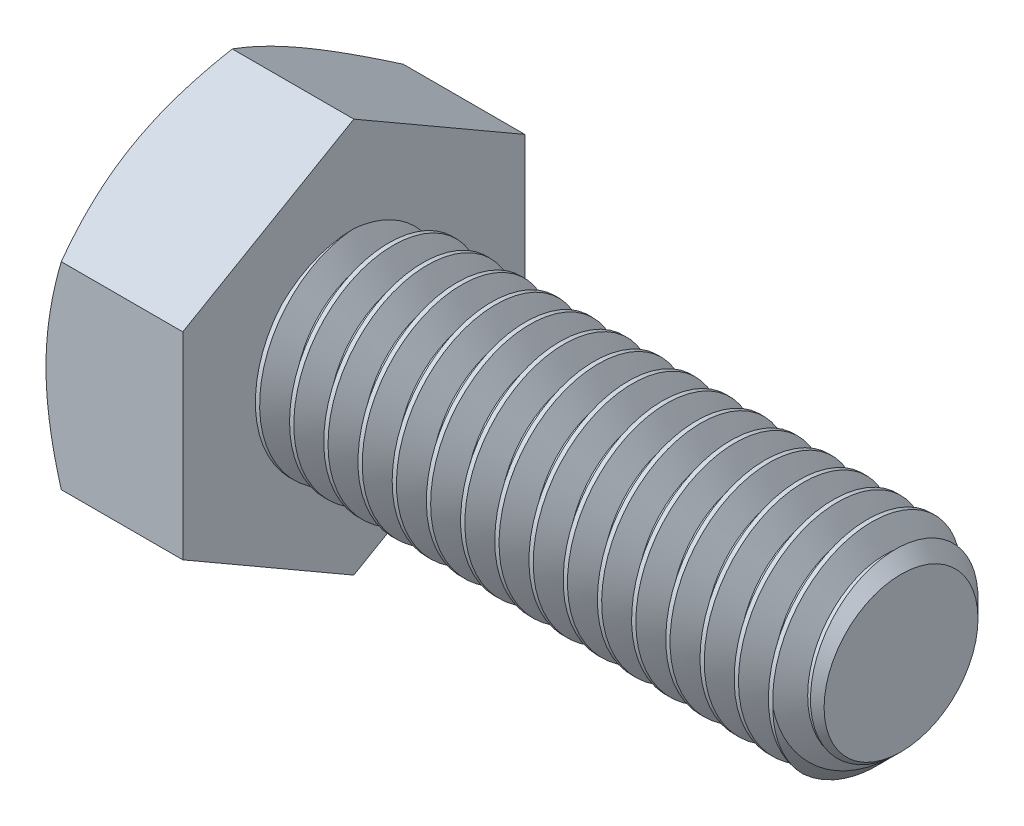
from build123d import *

# Parameters (mm, degrees)
SKETCH2_R           = 3
BOSS_EXTRUDE1_DEPTH = 16
CHAMFER1_SIZE       = 0.75
CUT_SWEEP1_PITCH    = 1
BOSS_EXTRUDE2_DEPTH = 4
SKETCH6_OUTSIDE_W   = 94.66
SKETCH6_OUTSIDE_H   = 96.208
SKETCH6_OUTSIDE_R   = 5
CUT_EXTRUDE1_DEPTH  = 22.408721108
CUT_EXTRUDE1_DRAFT  = -60
SKETCH7_W           = 0.197562976
SKETCH7_H           = 0.197562976
CUT_EXTRUDE2_DEPTH  = 0.25


with BuildPart() as part:
    # Sketch2 → Boss-Extrude1 (new body)
    with BuildSketch(Plane(origin=(10, 0, 0), x_dir=(0, 0, -1), z_dir=(1, 0, 0))):
        Circle(SKETCH2_R)
    extrude(amount=-BOSS_EXTRUDE1_DEPTH)

    # Chamfer1
    chamfer1_edges = [part.edges().sort_by_distance(p)[0] for p in [
        (10, 0, 3),
    ]]
    chamfer(chamfer1_edges, length=CHAMFER1_SIZE)

    # Cut-Sweep1: arcs per turn and ends read off the stored shape
    # Cut-Sweep1: the profile of Sketch5 profile screwed along a right-hand helix through 17 turns, 8 arcs to a turn; built about Z, then put on its axis
    cut_sweep1_z = Axis((0, 0, 0), (0, 0, 1))
    cut_sweep1_corners = [(3.0003, 0, 0.000173205), (2.350480947, 0, -0.375), (2.350480947, 0, -0.5), (3.0003, 0, -0.875173205)]
    with BuildLine(mode=Mode.PRIVATE) as cut_sweep1_profile:
        Line(cut_sweep1_corners[0], cut_sweep1_corners[1])
        Line(cut_sweep1_corners[1], cut_sweep1_corners[2])
        Line(cut_sweep1_corners[2], cut_sweep1_corners[3])
        Line(cut_sweep1_corners[3], cut_sweep1_corners[0])
    cut_sweep1_cap = Face(cut_sweep1_profile.wire())
    cut_sweep1_turn_angles = [0, 22.5, 45, 67.5, 90, 112.5, 135, 157.5, 180, 202.5, 225, 247.5, 270, 292.5, 315, 337.5, 360]
    cut_sweep1_turn_weights = [1, 0.9238795325112867, 1, 0.9238795325112867, 1, 0.9238795325112867, 1, 0.9238795325112867, 1, 0.9238795325112867, 1, 0.9238795325112867, 1, 0.9238795325112867, 1, 0.9238795325112867, 1]
    cut_sweep1_turn_rails = [Edge.make_bspline([Vector(p[0], p[1], 0).rotate(cut_sweep1_z, cut_sweep1_turn_angles[k]) / cut_sweep1_turn_weights[k] + Vector(0, 0, p[2] + CUT_SWEEP1_PITCH * cut_sweep1_turn_angles[k] / 360) for k in range(17)], [0, 0, 0, 1, 1, 2, 2, 3, 3, 4, 4, 5, 5, 6, 6, 7, 7, 8, 8, 8], 2, cut_sweep1_turn_weights) for p in cut_sweep1_corners]
    cut_sweep1_turn_sides = [Face.make_surface_from_curves(cut_sweep1_turn_rails[p[0]], cut_sweep1_turn_rails[p[1]]) for p in [(0, 1), (1, 2), (2, 3), (3, 0)]]
    cut_sweep1 = Plane(origin=(10, 0, 0), x_dir=(0, 1, 0), z_dir=(-1, 0, 0)) * Solid(Shell([*[p.moved(Location((0, 0, CUT_SWEEP1_PITCH * i))) for i in range(17) for p in cut_sweep1_turn_sides], cut_sweep1_cap, cut_sweep1_cap.rotate(cut_sweep1_z, 6120).moved(Location((0, 0, CUT_SWEEP1_PITCH * 6120 / 360)))]))
    add(cut_sweep1, mode=Mode.SUBTRACT)

    # Sketch3 → Boss-Extrude2 (add)
    with BuildSketch(Plane.ZY.offset(6)):
        Polygon((-5, -2.886751346), (0, -5.773502692), (5, -2.886751346), (5, 2.886751346), (0, 5.773502692), (-5, 2.886751346), align=None)
    extrude(amount=BOSS_EXTRUDE2_DEPTH)


with BuildPart() as cut_extrude1_tool:
    # Sketch6 outside → Cut-Extrude1 (with draft: the straight prism first)
    with BuildSketch(Plane.ZY.offset(10)):
        Rectangle(SKETCH6_OUTSIDE_W, SKETCH6_OUTSIDE_H)
        Circle(SKETCH6_OUTSIDE_R, mode=Mode.SUBTRACT)
    extrude(amount=-CUT_EXTRUDE1_DEPTH)
    # Cut-Extrude1: the draft: its side faces are tilted about the plane it starts from
    cut_extrude1_sides = [cut_extrude1_tool.faces().sort_by_distance(p)[0] for p in [
        (1.204360554, -48.104, 0),
        (1.204360554, 0, 47.33),
        (1.204360554, 48.104, 0),
        (1.204360554, 0, -47.33),
        (1.204360554, 0, -5),
    ]]
    draft(cut_extrude1_sides, Plane.ZY.offset(10), CUT_EXTRUDE1_DRAFT)


with BuildPart() as part_1:
    add(part.part)

    # Cut-Extrude1: cut by cut_extrude1_tool
    add(cut_extrude1_tool.part, mode=Mode.SUBTRACT)

    # Sketch7 → Cut-Extrude2 (cut)
    # profile 1 of 4: a face of its own
    with BuildSketch(Plane.ZY.offset(10)):
        with BuildLine():
            Line((-1.284159342, 2.5), (-1.481722318, 2.5))
            Line((-1.481722318, 2.5), (-1.481722318, 3.700812462))
            add(Edge.make_bspline(
                [(-1.481722318, 3.700812462), (-1.493098012, 3.689842005), (-1.516741144, 3.667041113), (-1.556707362, 3.634772156), (-1.601314769, 3.602066201), (-1.649984109, 3.570615769), (-1.699594268, 3.541008578), (-1.7475361, 3.514381463), (-1.793009194, 3.491848462), (-1.822962567, 3.479527328), (-1.837335675, 3.47361504)],
                knots=[0, 0, 0, 0, 0.893362401, 1.856755847, 2.901947673, 4.020460078, 5.132200827, 6.168787962, 7.121294059, 8, 8, 8, 8], degree=3))
            Line((-1.837335675, 3.47361504), (-1.837335675, 3.655743408))
            add(Edge.make_bspline(
                [(-1.837335675, 3.655743408), (-1.812648378, 3.668457416), (-1.763991177, 3.693515971), (-1.695249075, 3.736795542), (-1.631070927, 3.783712378), (-1.572519137, 3.834256092), (-1.520031188, 3.885920841), (-1.475798832, 3.938052602), (-1.438788011, 3.98874045), (-1.42021898, 4.024089603), (-1.411340508, 4.040991211)],
                knots=[0, 0, 0, 0, 1.141258006, 2.249351951, 3.335817539, 4.406819942, 5.426913362, 6.360259544, 7.215985427, 8, 8, 8, 8], degree=3))
            Line((-1.411340508, 4.040991211), (-1.284159342, 4.040991211))
            Line((-1.284159342, 4.040991211), (-1.284159342, 2.5))
        make_face()
    # profile 2 of 4: a face of its own
    with BuildSketch(Plane.ZY.offset(10)):
        with BuildLine():
            add(Edge.make_bspline(
                [(-0.790251903, 3.260000072), (-0.790052858, 3.282022251), (-0.789663013, 3.325154426), (-0.787244933, 3.388264546), (-0.783023159, 3.448197614), (-0.776721214, 3.50490158), (-0.769258531, 3.558504437), (-0.759556995, 3.608929689), (-0.748641356, 3.656290471), (-0.735544549, 3.700537418), (-0.721155446, 3.742050974), (-0.704830549, 3.780764541), (-0.686462825, 3.816637074), (-0.666954934, 3.85004059), (-0.645279941, 3.880455529), (-0.622746104, 3.908735457), (-0.597715799, 3.933843239), (-0.57122984, 3.956424902), (-0.542898213, 3.976351902), (-0.512870822, 3.993546501), (-0.481263204, 4.008728091), (-0.447472952, 4.020156788), (-0.412201546, 4.029473599), (-0.375177484, 4.036327159), (-0.336359967, 4.040367563), (-0.309833651, 4.04078098), (-0.296344464, 4.040991211)],
                knots=[0, 0, 0, 0, 1.514747001, 2.966751498, 4.343369068, 5.64627492, 6.890416844, 8.064737671, 9.177176366, 10.232018008, 11.237056675, 12.19799043, 13.119080079, 14.007588942, 14.855863561, 15.685992447, 16.491747269, 17.290132607, 18.077525251, 18.870243746, 19.668095604, 20.485086593, 21.319398728, 22.175900658, 23.072407314, 24, 24, 24, 24], degree=3))
            add(Edge.make_bspline(
                [(-0.296344464, 4.040991211), (-0.276554072, 4.040409387), (-0.237675053, 4.039266372), (-0.180911485, 4.029944144), (-0.127415481, 4.013997036), (-0.077221797, 3.992483699), (-0.031188485, 3.965157621), (0.009921203, 3.93193861), (0.045663832, 3.893175459), (0.075649327, 3.848408838), (0.101859643, 3.798873708), (0.125144312, 3.744347738), (0.146192977, 3.68489203), (0.161129567, 3.631670872), (0.171783825, 3.585728479), (0.178836097, 3.547836494), (0.184690897, 3.506950828), (0.189176465, 3.463170395), (0.192856768, 3.416544299), (0.195698897, 3.36704351), (0.197141568, 3.314544309), (0.197419873, 3.278522328), (0.197562976, 3.260000072)],
                knots=[0, 0, 0, 0, 1.134486744, 2.228744715, 3.287356444, 4.328707449, 5.352829806, 6.347195599, 7.349461267, 8.364207941, 9.428085653, 10.559314403, 11.761222316, 13.04268526, 13.726896727, 14.465273606, 15.252205015, 16.094778733, 16.988606776, 17.934225168, 18.937792761, 20, 20, 20, 20], degree=3))
            add(Edge.make_bspline(
                [(0.197562976, 3.260000072), (0.197360203, 3.238081335), (0.196964045, 3.195258767), (0.194610758, 3.132654684), (0.190134593, 3.073173782), (0.184626591, 3.016679807), (0.176294137, 2.963323573), (0.167315467, 2.912878383), (0.156211069, 2.865573301), (0.143254845, 2.821387596), (0.128663193, 2.78008763), (0.11266119, 2.74136128), (0.094937435, 2.705235008), (0.074964401, 2.672061172), (0.053655947, 2.641399446), (0.03085601, 2.613134809), (0.006081205, 2.587674071), (-0.020643434, 2.565160142), (-0.048776137, 2.544879764), (-0.07887653, 2.527515404), (-0.110812868, 2.513129332), (-0.144371773, 2.500829956), (-0.179893749, 2.491817695), (-0.217098671, 2.484918949), (-0.256123623, 2.480856468), (-0.282752541, 2.480450776), (-0.296344464, 2.480243702)],
                knots=[0, 0, 0, 0, 1.508974709, 2.94807912, 4.311757619, 5.615040294, 6.854280449, 8.028314546, 9.141715822, 10.197470207, 11.196696834, 12.155719058, 13.080757287, 13.963948316, 14.818758719, 15.649605906, 16.461113142, 17.260189315, 18.052359509, 18.845763934, 19.647754795, 20.461145776, 21.303032214, 22.167241874, 23.064524267, 24, 24, 24, 24], degree=3))
            add(Edge.make_bspline(
                [(-0.296344464, 2.480243702), (-0.31416505, 2.480752036), (-0.348910289, 2.481743145), (-0.399653148, 2.488477126), (-0.447278028, 2.500329248), (-0.492186617, 2.516224614), (-0.533874131, 2.537485582), (-0.572539611, 2.563353701), (-0.608960011, 2.593227122), (-0.629925808, 2.616796566), (-0.64053621, 2.628724626)],
                knots=[0, 0, 0, 0, 1.10322584, 2.150986741, 3.161425019, 4.136713905, 5.093944212, 6.049774532, 7.013026876, 8, 8, 8, 8], degree=3))
            add(Edge.make_bspline(
                [(-0.64053621, 2.628724626), (-0.652749028, 2.646341795), (-0.677932381, 2.682669151), (-0.707407312, 2.744610663), (-0.733699472, 2.81279957), (-0.754333998, 2.888573732), (-0.770495975, 2.971330072), (-0.782168957, 3.061230974), (-0.788774716, 3.158237599), (-0.789748392, 3.225313505), (-0.790251903, 3.260000072)],
                knots=[0, 0, 0, 0, 0.779365345, 1.607084704, 2.489375761, 3.438383567, 4.461919411, 5.557722155, 6.737039282, 8, 8, 8, 8], degree=3))
        make_face()
        with BuildLine():
            add(Edge.make_bspline(
                [(-0.592688927, 3.260617457), (-0.592492763, 3.230978591), (-0.592117261, 3.174243246), (-0.588194178, 3.093187016), (-0.581440751, 3.020063233), (-0.57251228, 2.954973141), (-0.560723083, 2.897828693), (-0.545920352, 2.84877551), (-0.529234153, 2.807224843), (-0.508585298, 2.77369168), (-0.485977083, 2.746357261), (-0.462635646, 2.722848776), (-0.438011843, 2.702867102), (-0.412266343, 2.686206461), (-0.384999685, 2.673592119), (-0.356510025, 2.664449215), (-0.326791165, 2.659187614), (-0.30655127, 2.658431621), (-0.296344464, 2.658050381)],
                knots=[0, 0, 0, 0, 1.89448813, 3.626469325, 5.185477471, 6.587276848, 7.82441448, 8.910550357, 9.859733512, 10.6775885, 11.416198291, 12.123144072, 12.791880183, 13.439617036, 14.078171869, 14.70637855, 15.347637704, 16, 16, 16, 16], degree=3))
            add(Edge.make_bspline(
                [(-0.296344464, 2.658050381), (-0.286140213, 2.658439952), (-0.265905387, 2.659212463), (-0.236117858, 2.66435804), (-0.207739045, 2.673971614), (-0.180513042, 2.686541403), (-0.154580415, 2.702822298), (-0.130077548, 2.722879447), (-0.106613153, 2.746373973), (-0.084106493, 2.774026105), (-0.063614954, 2.807714303), (-0.046615742, 2.849231123), (-0.032043703, 2.898370213), (-0.020189817, 2.955485547), (-0.011224514, 3.020472726), (-0.00451192, 3.093393697), (-0.000562582, 3.174345633), (-0.000193277, 3.230978457), (0, 3.260617457)],
                knots=[0, 0, 0, 0, 0.652509534, 1.29391342, 1.924290653, 2.562989607, 3.207355802, 3.876242846, 4.583348185, 5.32723334, 6.150888545, 7.094226006, 8.186903555, 9.424320409, 10.81992305, 12.379283064, 14.105084285, 16, 16, 16, 16], degree=3))
            add(Edge.make_bspline(
                [(0, 3.260617457), (-0.000187089, 3.289639765), (-0.000545544, 3.345245408), (-0.00459674, 3.424740087), (-0.010945329, 3.496636517), (-0.01962919, 3.56100098), (-0.03117004, 3.6177636), (-0.045167517, 3.667045216), (-0.061847603, 3.708740728), (-0.081680166, 3.743268967), (-0.103757778, 3.77159149), (-0.126819935, 3.796107098), (-0.151443196, 3.816956825), (-0.178063809, 3.833682782), (-0.205823744, 3.847176663), (-0.235360851, 3.856463495), (-0.266384805, 3.862169035), (-0.287676143, 3.862842166), (-0.298505309, 3.863184533)],
                knots=[0, 0, 0, 0, 1.850066095, 3.544656626, 5.0727657, 6.45041401, 7.682899467, 8.762389858, 9.712573485, 10.538438529, 11.291566246, 11.996865408, 12.681389046, 13.341983376, 13.996294293, 14.643563182, 15.31009126, 16, 16, 16, 16], degree=3))
            add(Edge.make_bspline(
                [(-0.298505309, 3.863184533), (-0.308711474, 3.862916661), (-0.328836725, 3.862388453), (-0.358302727, 3.857346709), (-0.386227312, 3.84891579), (-0.412930404, 3.837495291), (-0.437745374, 3.822125556), (-0.461656324, 3.804180295), (-0.483543356, 3.782315999), (-0.49673229, 3.765970592), (-0.503476896, 3.757611818)],
                knots=[0, 0, 0, 0, 1.021318143, 2.013908504, 2.982026795, 3.937174072, 4.91255697, 5.897578595, 6.924855925, 8, 8, 8, 8], degree=3))
            add(Edge.make_bspline(
                [(-0.503476896, 3.757611818), (-0.510819714, 3.745335366), (-0.5263262, 3.719410087), (-0.543677057, 3.674350882), (-0.559004117, 3.622856788), (-0.57162337, 3.56413553), (-0.580752514, 3.49828784), (-0.58795962, 3.425390186), (-0.591703443, 3.345340795), (-0.592351369, 3.289637751), (-0.592688927, 3.260617457)],
                knots=[0, 0, 0, 0, 0.671104906, 1.417232262, 2.260109084, 3.195198885, 4.23592645, 5.382417421, 6.636286093, 8, 8, 8, 8], degree=3))
        make_face(mode=Mode.SUBTRACT)
    # profile 3 of 4: a face of its own
    with BuildSketch(Plane.ZY.offset(10)):
        with Locations((0.592688927, 2.598781488)):
            Rectangle(SKETCH7_W, SKETCH7_H)
    # profile 4 of 4: a face of its own
    with BuildSketch(Plane.ZY.offset(10)):
        with BuildLine():
            Line((1.007571176, 2.875369654), (1.205134152, 2.895125952))
            add(Edge.make_bspline(
                [(1.205134152, 2.895125952), (1.206920239, 2.885003602), (1.210372897, 2.865436243), (1.218164458, 2.837549402), (1.226067012, 2.811547623), (1.236268145, 2.788010165), (1.246891881, 2.766297683), (1.258922971, 2.746627755), (1.272575767, 2.729395444), (1.291855309, 2.709202247), (1.319210172, 2.688130304), (1.357127719, 2.671061208), (1.398840582, 2.65958445), (1.428236664, 2.658573426), (1.443444492, 2.658050381)],
                knots=[0, 0, 0, 0, 0.994516507, 1.922484754, 2.80151264, 3.623050913, 4.402748861, 5.140924173, 5.850441436, 6.526872911, 7.841975818, 9.161260782, 10.53140107, 12, 12, 12, 12], degree=3))
            add(Edge.make_bspline(
                [(1.443444492, 2.658050381), (1.456751488, 2.658529578), (1.482941721, 2.659472712), (1.521127946, 2.666783962), (1.557442454, 2.678496432), (1.591253108, 2.695301374), (1.622436856, 2.71575252), (1.649674808, 2.7400526), (1.673330676, 2.767155041), (1.692759492, 2.798382253), (1.709342511, 2.83404897), (1.725011258, 2.8746088), (1.739833634, 2.920760517), (1.753006889, 2.971915473), (1.764802895, 3.026206092), (1.773081217, 3.082402208), (1.778174547, 3.13941128), (1.778719417, 3.177774463), (1.778992858, 3.197026874)],
                knots=[0, 0, 0, 0, 0.897794352, 1.766998465, 2.614902619, 3.466100941, 4.308008728, 5.124841802, 5.922729683, 6.728261092, 7.598214292, 8.574707161, 9.662086263, 10.868425066, 12.139522319, 13.41071447, 14.70057738, 16, 16, 16, 16], degree=3))
            add(Edge.make_bspline(
                [(1.778992858, 3.197026874), (1.778899344, 3.202274865), (1.778675616, 3.214830375), (1.778290769, 3.227382036), (1.778066782, 3.234687316)],
                knots=[0, 0, 0, 0, 0.835966126, 2, 2, 2, 2], degree=3))
            add(Edge.make_bspline(
                [(1.778066782, 3.234687316), (1.768542584, 3.22022413), (1.749509536, 3.191321063), (1.714445959, 3.152529649), (1.674332612, 3.118121138), (1.629778386, 3.088362715), (1.58188343, 3.063940569), (1.531480967, 3.046194448), (1.479005485, 3.035236452), (1.443291513, 3.034030076), (1.425231655, 3.033420035)],
                knots=[0, 0, 0, 0, 0.978840568, 1.956103883, 2.947027447, 3.962820877, 4.980997961, 5.980964245, 6.979013046, 8, 8, 8, 8], degree=3))
            add(Edge.make_bspline(
                [(1.425231655, 3.033420035), (1.410181713, 3.033809962), (1.380555612, 3.034577542), (1.337158587, 3.041399547), (1.295419155, 3.051630137), (1.255732843, 3.067119745), (1.21748219, 3.086276405), (1.181068826, 3.109789736), (1.146436643, 3.137627733), (1.114033143, 3.169443767), (1.084462099, 3.2049069), (1.05838385, 3.243153184), (1.036728508, 3.28436963), (1.018710514, 3.328041798), (1.004807734, 3.374591649), (0.995147123, 3.423910112), (0.988649898, 3.475808926), (0.98809691, 3.511357846), (0.987814879, 3.529488319)],
                knots=[0, 0, 0, 0, 0.975490236, 1.920271282, 2.842894855, 3.757591483, 4.67685385, 5.613562631, 6.563069669, 7.554119451, 8.55387214, 9.553424333, 10.550567425, 11.568071726, 12.613215376, 13.695622473, 14.824733476, 16, 16, 16, 16], degree=3))
            add(Edge.make_bspline(
                [(0.987814879, 3.529488319), (0.988237289, 3.548232953), (0.989063596, 3.584900708), (0.995305351, 3.63851352), (1.005631769, 3.689304987), (1.020691426, 3.737178163), (1.039315186, 3.782440645), (1.062799025, 3.824766099), (1.090238676, 3.864335583), (1.12179809, 3.900767612), (1.1564816, 3.933457226), (1.193305446, 3.962633275), (1.232749472, 3.986615849), (1.274057373, 4.006611333), (1.317541757, 4.022064144), (1.363128302, 4.033233279), (1.410943155, 4.039786979), (1.443527149, 4.040584988), (1.460113868, 4.040991211)],
                knots=[0, 0, 0, 0, 1.151671969, 2.252870106, 3.311924673, 4.331900944, 5.332425074, 6.314476151, 7.300265758, 8.286521684, 9.270545387, 10.225535917, 11.167946231, 12.101233205, 13.04124339, 13.998220545, 14.981004193, 16, 16, 16, 16], degree=3))
            add(Edge.make_bspline(
                [(1.460113868, 4.040991211), (1.472160605, 4.04074757), (1.49610549, 4.040263292), (1.53174045, 4.036565994), (1.56653158, 4.029901008), (1.600705712, 4.021487923), (1.633686425, 4.009809927), (1.666109474, 3.996305519), (1.697583789, 3.979788608), (1.728292766, 3.961006809), (1.758043531, 3.940290273), (1.78541595, 3.916489215), (1.811504082, 3.891230711), (1.835777069, 3.863722031), (1.857467159, 3.833538628), (1.878046883, 3.801747632), (1.896524197, 3.767655353), (1.913374225, 3.731215619), (1.928371403, 3.691678329), (1.940882807, 3.648169752), (1.951607872, 3.600539191), (1.960537546, 3.548723511), (1.967159045, 3.492759655), (1.972032081, 3.432730793), (1.975222249, 3.368591267), (1.975491252, 3.324417814), (1.975629758, 3.301673513)],
                knots=[0, 0, 0, 0, 0.850689348, 1.69088598, 2.526071361, 3.350886897, 4.173587108, 4.994166539, 5.82944675, 6.680632524, 7.535501428, 8.385942454, 9.238956306, 10.098905971, 10.972410977, 11.861345628, 12.77184846, 13.708225841, 14.694799433, 15.754852217, 16.902446579, 18.141290626, 19.466225842, 20.880733292, 22.39393263, 24, 24, 24, 24], degree=3))
            add(Edge.make_bspline(
                [(1.975629758, 3.301673513), (1.975490325, 3.277900399), (1.975218576, 3.231567557), (1.972003363, 3.163933366), (1.967132776, 3.099998865), (1.960506598, 3.039722069), (1.951514674, 2.983194972), (1.940827057, 2.930427456), (1.928222834, 2.881322105), (1.913411036, 2.835874606), (1.896572884, 2.793562676), (1.878123243, 2.753865304), (1.857460667, 2.716841197), (1.834817321, 2.682419349), (1.81048396, 2.650539597), (1.784080657, 2.621287341), (1.755598839, 2.594751007), (1.725401557, 2.570631953), (1.69353413, 2.54937701), (1.660430384, 2.530622167), (1.625716723, 2.515258667), (1.589750014, 2.502655004), (1.552594169, 2.492248635), (1.513946549, 2.485236805), (1.473985704, 2.481265544), (1.446951668, 2.480587277), (1.433257651, 2.480243702)],
                knots=[0, 0, 0, 0, 1.538356107, 2.998194159, 4.380716326, 5.687456969, 6.921258146, 8.08355215, 9.170518603, 10.200253214, 11.174652363, 12.115998813, 13.031191965, 13.915860606, 14.780247615, 15.624154577, 16.462764255, 17.29681422, 18.1223677, 18.939254916, 19.756006416, 20.575278551, 21.404021733, 22.250368457, 23.113728878, 24, 24, 24, 24], degree=3))
            add(Edge.make_bspline(
                [(1.433257651, 2.480243702), (1.418732748, 2.480494839), (1.390314716, 2.480986189), (1.348827314, 2.486152771), (1.309305056, 2.494007659), (1.271862965, 2.505603334), (1.236220636, 2.519877298), (1.202986414, 2.538118612), (1.171569683, 2.559163632), (1.142358031, 2.583436747), (1.115693486, 2.610848821), (1.091567168, 2.640724272), (1.070415495, 2.673450039), (1.052349162, 2.70883318), (1.036346581, 2.746576015), (1.023940229, 2.787184652), (1.013861262, 2.83028456), (1.00970173, 2.860098607), (1.007571176, 2.875369654)],
                knots=[0, 0, 0, 0, 1.08199657, 2.11693069, 3.111083497, 4.081436044, 5.034173265, 5.967546613, 6.901297947, 7.84883568, 8.792454994, 9.747011506, 10.706361727, 11.690764787, 12.70483191, 13.757514363, 14.851376857, 16, 16, 16, 16], degree=3))
        make_face()
        with BuildLine():
            add(Edge.make_bspline(
                [(1.778066782, 3.533810009), (1.777844584, 3.546167498), (1.777412091, 3.570220558), (1.773622923, 3.605313673), (1.767526176, 3.638360963), (1.758968941, 3.669552455), (1.747347963, 3.698557507), (1.733885852, 3.72605331), (1.717423045, 3.751277762), (1.698847657, 3.774570528), (1.678386493, 3.79540537), (1.656104474, 3.813571489), (1.632419371, 3.829143971), (1.606762975, 3.84138813), (1.579978695, 3.851477273), (1.551423134, 3.858071145), (1.521489215, 3.862690284), (1.500880058, 3.863017562), (1.490365698, 3.863184533)],
                knots=[0, 0, 0, 0, 1.20361398, 2.342757417, 3.433960756, 4.474970456, 5.487648377, 6.473933575, 7.452701285, 8.415527761, 9.372491588, 10.291530068, 11.211879743, 12.12647906, 13.055739058, 13.994253148, 14.97671008, 16, 16, 16, 16], degree=3))
            add(Edge.make_bspline(
                [(1.490365698, 3.863184533), (1.479550713, 3.862856809), (1.458245164, 3.862211193), (1.427017644, 3.858053397), (1.397402188, 3.850092498), (1.36919886, 3.839532546), (1.342094419, 3.826470071), (1.317074221, 3.809354236), (1.29309033, 3.789957753), (1.271104705, 3.76745525), (1.251021561, 3.742783687), (1.233326098, 3.716174633), (1.218424276, 3.687615052), (1.206512128, 3.657224018), (1.19677715, 3.625266419), (1.190089912, 3.591456506), (1.18597516, 3.555830273), (1.185579924, 3.531454958), (1.185377855, 3.518992786)],
                knots=[0, 0, 0, 0, 1.007165334, 1.984118292, 2.925321257, 3.856078893, 4.785899085, 5.718627206, 6.671847665, 7.654235469, 8.641842333, 9.630378272, 10.624608936, 11.635186472, 12.665777387, 13.731187195, 14.840042241, 16, 16, 16, 16], degree=3))
            add(Edge.make_bspline(
                [(1.185377855, 3.518992786), (1.185564481, 3.50786364), (1.185930382, 3.48604371), (1.190287864, 3.454199511), (1.196100099, 3.423807131), (1.2053659, 3.395176801), (1.216528497, 3.367892863), (1.231036441, 3.342581934), (1.247371005, 3.318487167), (1.266510109, 3.29641574), (1.287668429, 3.276393087), (1.31077761, 3.258941189), (1.335545758, 3.244002062), (1.36220298, 3.231978182), (1.390589415, 3.222718025), (1.420641701, 3.215900682), (1.452490468, 3.211840104), (1.474301842, 3.211433897), (1.485426624, 3.211226713)],
                knots=[0, 0, 0, 0, 1.102204012, 2.160993585, 3.181057555, 4.164839289, 5.138418409, 6.097303793, 7.050641095, 8.019669129, 8.986440483, 9.932879371, 10.884360123, 11.847412593, 12.824617322, 13.839006415, 14.897795988, 16, 16, 16, 16], degree=3))
            add(Edge.make_bspline(
                [(1.485426624, 3.211226713), (1.495831895, 3.211435921), (1.516311795, 3.211847691), (1.546312698, 3.215925579), (1.574819195, 3.222755565), (1.601959278, 3.232041219), (1.627688956, 3.244060942), (1.651835213, 3.259118787), (1.674864814, 3.276371256), (1.696102673, 3.296529924), (1.715513299, 3.318849511), (1.732299881, 3.343550515), (1.746634721, 3.37018436), (1.7579177, 3.399066744), (1.76695483, 3.429842075), (1.773317571, 3.462705196), (1.777484418, 3.497585953), (1.777869725, 3.521552704), (1.778066782, 3.533810009)],
                knots=[0, 0, 0, 0, 1.017004716, 2.00169281, 2.953445817, 3.879374072, 4.80207141, 5.723561102, 6.657273834, 7.611045633, 8.581233951, 9.544037932, 10.525327521, 11.53237926, 12.57032081, 13.657564536, 14.802009319, 16, 16, 16, 16], degree=3))
        make_face(mode=Mode.SUBTRACT)
    extrude(amount=-CUT_EXTRUDE2_DEPTH, mode=Mode.SUBTRACT)


solid = part_1.part
